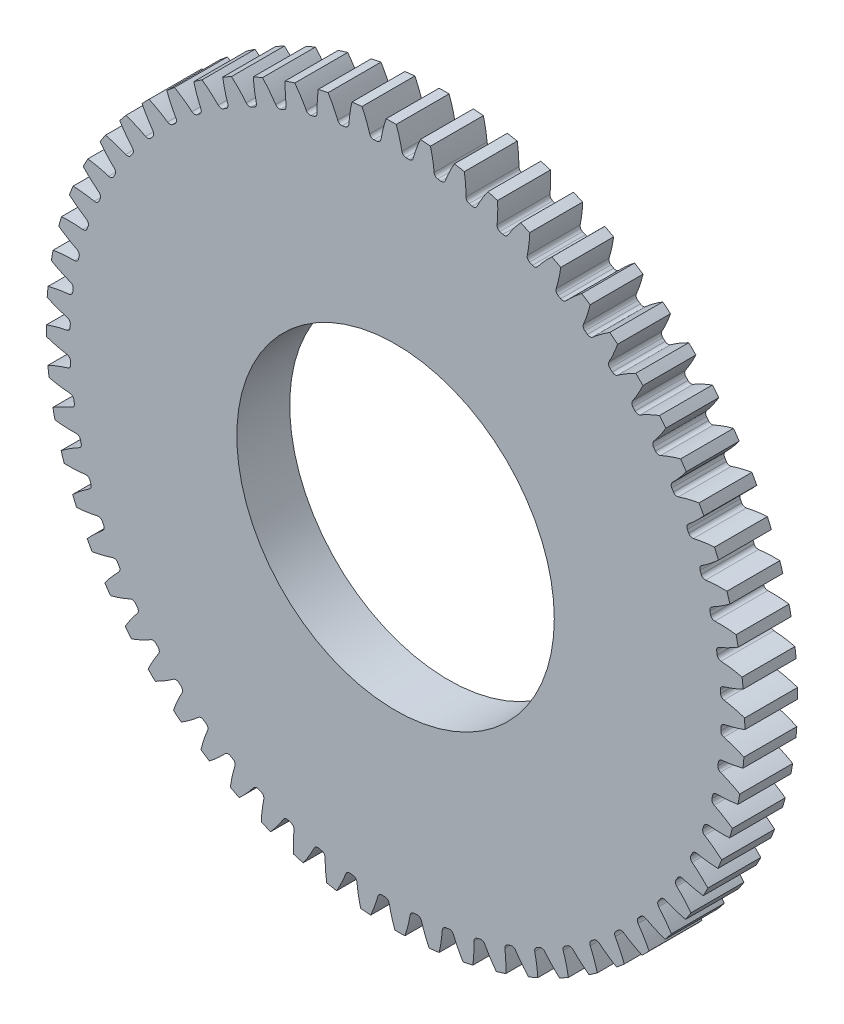
from build123d import *

# Parameters (mm, degrees)
SKETCH3_R         = 41.91
GEARBODY_DEPTH    = 6.35
TOOTHCUT_DEPTH    = 60.60888105
CIRPATTERN1_COUNT = 64
BOREDIA_R         = 19.05
BORE_DEPTH        = 12700


with BuildPart() as part:
    # Sketch3 → gearBody (new body)
    with BuildSketch(Plane.XY):
        Circle(SKETCH3_R)
    extrude(amount=GEARBODY_DEPTH)

    # Sketch2 → toothCut (cut, through all)
    with BuildSketch(Plane.XY):
        with BuildLine():
            ThreePointArc((39.031726069, -1.616852216), (39.039033465, -1.429586365), (39.045442404, -1.242287613))
            ThreePointArc((39.045442404, -1.242287613), (39.164057208, -0.934854327), (39.448415717, -0.768346262))
            ThreePointArc((39.448415717, -0.768346262), (45.224956892, 1.592886681), (49.672426571, 5.97054158))
            ThreePointArc((49.672426571, 5.97054158), (49.996453383, -1.830840615), (49.102695574, -9.587628256))
            ThreePointArc((49.102695574, -9.587628256), (44.987322783, -4.89640712), (39.398955649, -2.118997942))
            ThreePointArc((39.398955649, -2.118997942), (39.127537281, -1.932137656), (39.031726069, -1.616852216))
        make_face()
    toothcut = extrude(amount=TOOTHCUT_DEPTH, mode=Mode.SUBTRACT)

    # CirPattern1: toothCut ×64 about axis
    cirpattern1_axis = Axis((0, 0, 6.35), (0, 0, -1))
    for i in range(1, CIRPATTERN1_COUNT):
        add(toothcut.rotate(cirpattern1_axis, i * 360 / CIRPATTERN1_COUNT), mode=Mode.SUBTRACT)

    # boreDia → bore (cut, symmetric)
    with BuildSketch(Plane.XY):
        Circle(BOREDIA_R)
    extrude(amount=BORE_DEPTH, both=True, mode=Mode.SUBTRACT)


solid = part.part
